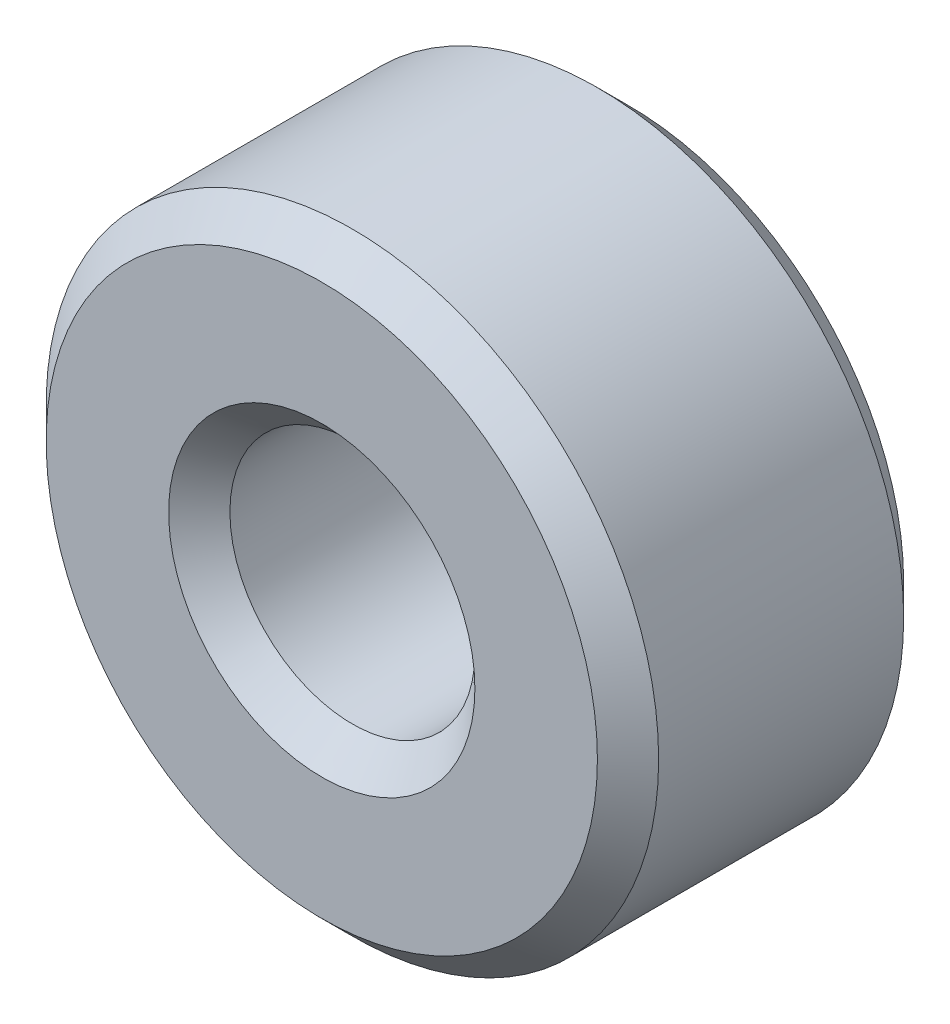
from build123d import *

# Parameters (mm, degrees)
SKETCH1_R           = 10
SKETCH1_R_2         = 4
BOSS_EXTRUDE1_DEPTH = 10
CHAMFER1_SIZE       = 1


with BuildPart() as part:
    # Sketch1 → Boss-Extrude1 (new body)
    with BuildSketch(Plane.XY):
        with Locations((-28.195752402, 6.260990337)):
            Circle(SKETCH1_R)
        with Locations((-28.195752402, 6.260990337)):
            Circle(SKETCH1_R_2, mode=Mode.SUBTRACT)
    extrude(amount=BOSS_EXTRUDE1_DEPTH)

    # Chamfer1
    chamfer1_edges = [part.edges().sort_by_distance(p)[0] for p in [
        (-38.195752402, 6.260990337, 0),
        (-38.195752402, 6.260990337, 10),
        (-32.195752402, 6.260990337, 0),
        (-32.195752402, 6.260990337, 10),
    ]]
    chamfer(chamfer1_edges, length=CHAMFER1_SIZE)


solid = part.part
